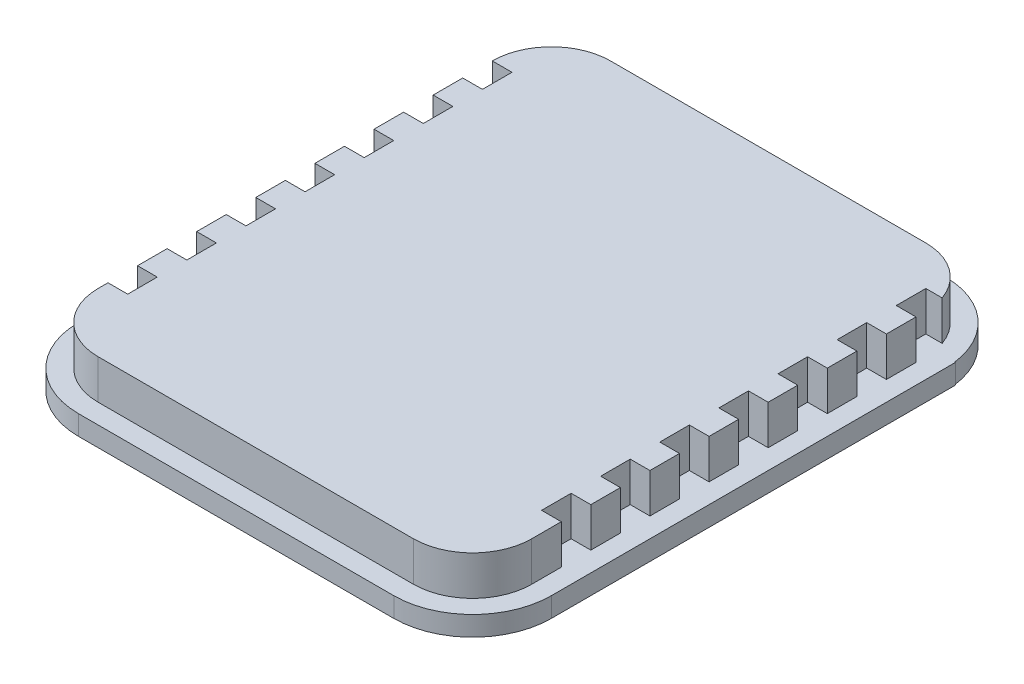
from build123d import *

# Parameters (mm, degrees)
SKETCH1_W              = 220
SKETCH1_H              = 260
BOSS_EXTRUDE1_DEPTH    = 20
FILLET1_R              = 30
CUT_EXTRUDE1_START     = -10
CUT_EXTRUDE1_OUTLINE_W = 15
CUT_EXTRUDE1_OUTLINE_H = 20
CUT_EXTRUDE1_DEPTH     = 10
SKETCH8_W              = 15
SKETCH8_H              = 20
CUT_EXTRUDE2_DEPTH     = 10
BOSS_EXTRUDE3_DEPTH    = 10


# Read off the part's stored shape, not the designer's step: Cut-Extrude1
with BuildPart() as part:
    # Sketch1 → Boss-Extrude1 (new body)
    with BuildSketch(Plane(origin=(0, 0, 0), x_dir=(1, 0, 0), z_dir=(0, 1, 0))):
        with Locations((110, 130)):
            Rectangle(SKETCH1_W, SKETCH1_H)
    extrude(amount=BOSS_EXTRUDE1_DEPTH)

    # Fillet1
    fillet1_edges = [part.edges().sort_by_distance(p)[0] for p in [
        (0, 10, -260),
        (220, 10, -260),
        (220, 10, 0),
        (0, 10, 0),
    ]]
    fillet(fillet1_edges, radius=FILLET1_R)

    # Cut-Extrude1 outline → Cut-Extrude1 (cut)
    with BuildSketch(Plane(origin=(220, 0, 0), x_dir=(0, 0, -1), z_dir=(1, 0, 0)).offset(CUT_EXTRUDE1_START)):
        with Locations((232.5, 10)):
            Rectangle(CUT_EXTRUDE1_OUTLINE_W, CUT_EXTRUDE1_OUTLINE_H)
        with Locations((202.5, 10)):
            Rectangle(CUT_EXTRUDE1_OUTLINE_W, CUT_EXTRUDE1_OUTLINE_H)
        with Locations((172.5, 10)):
            Rectangle(CUT_EXTRUDE1_OUTLINE_W, CUT_EXTRUDE1_OUTLINE_H)
        with Locations((142.5, 10)):
            Rectangle(CUT_EXTRUDE1_OUTLINE_W, CUT_EXTRUDE1_OUTLINE_H)
        with Locations((112.5, 10)):
            Rectangle(CUT_EXTRUDE1_OUTLINE_W, CUT_EXTRUDE1_OUTLINE_H)
        with Locations((82.5, 10)):
            Rectangle(CUT_EXTRUDE1_OUTLINE_W, CUT_EXTRUDE1_OUTLINE_H)
        with Locations((52.5, 10)):
            Rectangle(CUT_EXTRUDE1_OUTLINE_W, CUT_EXTRUDE1_OUTLINE_H)
    extrude(amount=CUT_EXTRUDE1_DEPTH, mode=Mode.SUBTRACT)

    # Sketch8 → Cut-Extrude2 (cut)
    with BuildSketch(Plane.ZY):
        with Locations((-222.5, 10)):
            Rectangle(SKETCH8_W, SKETCH8_H)
        with Locations((-192.5, 10)):
            Rectangle(SKETCH8_W, SKETCH8_H)
        with Locations((-162.5, 10)):
            Rectangle(SKETCH8_W, SKETCH8_H)
        with Locations((-132.5, 10)):
            Rectangle(SKETCH8_W, SKETCH8_H)
        with Locations((-102.5, 10)):
            Rectangle(SKETCH8_W, SKETCH8_H)
        with Locations((-72.5, 10)):
            Rectangle(SKETCH8_W, SKETCH8_H)
        with Locations((-42.5, 10)):
            Rectangle(SKETCH8_W, SKETCH8_H)
    extrude(amount=-CUT_EXTRUDE2_DEPTH, mode=Mode.SUBTRACT)

    # Sketch11 → Boss-Extrude3 (add)
    with BuildSketch(Plane.XZ):
        with BuildLine():
            Line((229.686269666, -235), (230, -235))
            Line((230, -235), (230, -30))
            ThreePointArc((230, -30), (218.284271247, -1.715728753), (190, 10))
            Line((190, 10), (30, 10))
            ThreePointArc((30, 10), (1.715728753, -1.715728753), (-10, -30))
            Line((-10, -30), (-10, -225))
            Line((-10, -225), (-9.686269666, -225))
            ThreePointArc((-9.686269666, -225), (0, -256.457513111), (30, -270))
            Line((30, -270), (190, -270))
            ThreePointArc((190, -270), (216.457513111, -260), (229.686269666, -235))
        make_face()
    extrude(amount=BOSS_EXTRUDE3_DEPTH)


solid = part.part
